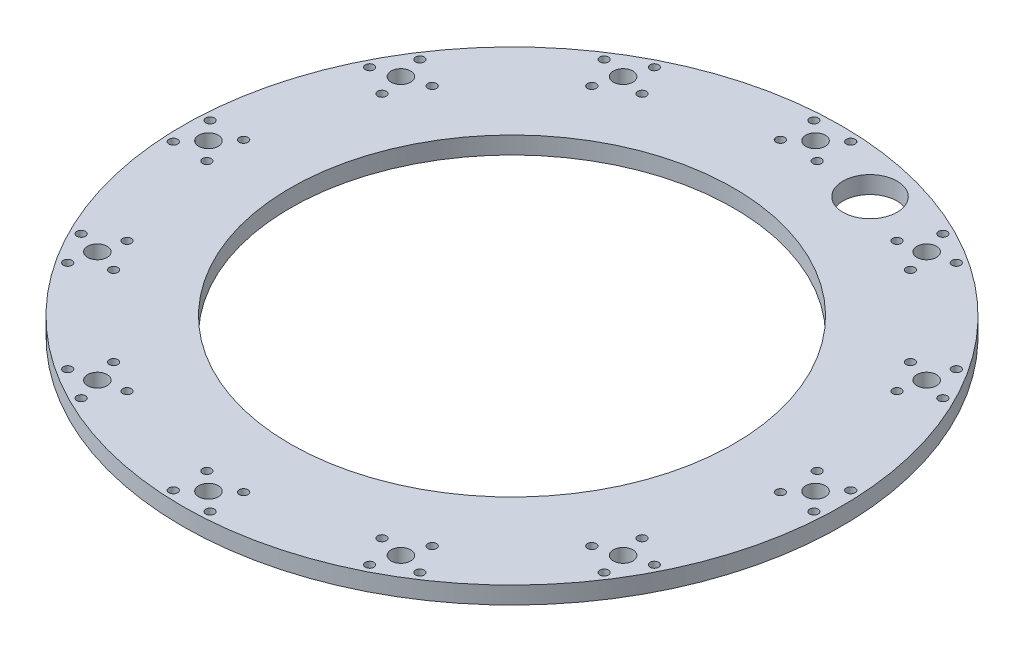
from build123d import *

# Parameters (mm, degrees)
SKETCH1_R           = 76.1
SKETCH1_R_2         = 51.2
BOSS_EXTRUDE1_DEPTH = 4
SKETCH2_R           = 2.25
SKETCH2_R_2         = 1
CUT_EXTRUDE1_DEPTH  = 108.695960927
CIRPATTERN1_COUNT   = 12
SKETCH3_R           = 6.25
CUT_EXTRUDE2_DEPTH  = 10


with BuildPart() as part:
    # Sketch1 → Boss-Extrude1 (new body)
    with BuildSketch(Plane(origin=(0, 0, 0), x_dir=(1, 0, 0), z_dir=(0, 1, 0))):
        Circle(SKETCH1_R)
        Circle(SKETCH1_R_2, mode=Mode.SUBTRACT)
    extrude(amount=BOSS_EXTRUDE1_DEPTH)

    # Sketch2 → Cut-Extrude1 (cut, through all)
    with BuildSketch(Plane(origin=(0, 4, 0), x_dir=(1, 0, 0), z_dir=(0, 1, 0))):
        with Locations((0, 70.091449319)):
            Circle(SKETCH2_R)
        with Locations((4.246572956, 73.968189977)):
            Circle(SKETCH2_R_2)
        with Locations((4.246572956, 66.214708661)):
            Circle(SKETCH2_R_2)
        with Locations((-4.246572956, 66.214708661)):
            Circle(SKETCH2_R_2)
        with Locations((-4.246572956, 73.968189977)):
            Circle(SKETCH2_R_2)
    cut_extrude1 = extrude(amount=-CUT_EXTRUDE1_DEPTH, mode=Mode.SUBTRACT)

    # CirPattern1: Cut-Extrude1 ×12 about axis
    cirpattern1_axis = Axis((0, -0.2, 0), (0, 1, 0))
    for i in range(1, CIRPATTERN1_COUNT):
        add(cut_extrude1.rotate(cirpattern1_axis, i * 360 / CIRPATTERN1_COUNT), mode=Mode.SUBTRACT)

    # Sketch3 → Cut-Extrude2 (cut)
    with BuildSketch(Plane(origin=(0, 4, 0), x_dir=(1, 0, 0), z_dir=(0, 1, 0))):
        with Locations((17.470285544, 65.199993275)):
            Circle(SKETCH3_R)
    extrude(amount=-CUT_EXTRUDE2_DEPTH, mode=Mode.SUBTRACT)


solid = part.part
